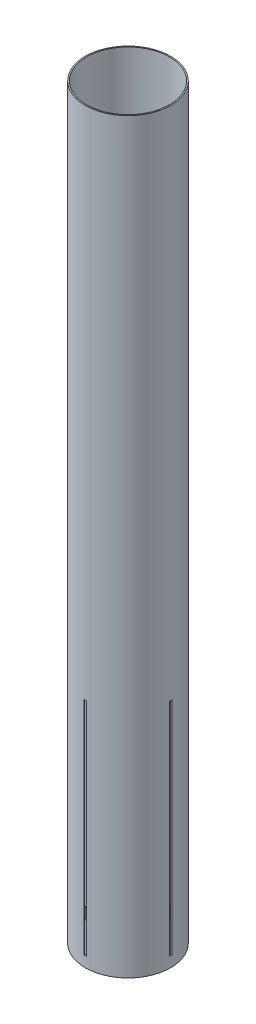
from build123d import *

# Parameters (mm, degrees)
SUSTAINER_TUBE_PROFILE_R   = 78.359
SUSTAINER_TUBE_PROFILE_R_2 = 76.2
SUSTAINER_TUBE_BODY_DEPTH  = 1371.6
FIN_SLOT_CUT_REACH         = 1384.746
FIN_SLOT_CUT_END_RADIUS    = 76.2
FIN_SLOT_PROFILE_W         = 4.7625
FIN_SLOT_PROFILE_H         = 406.4
FIN_SLOT_PATTERN_COUNT     = 4


with BuildPart() as part:
    # Sustainer Tube Profile → Sustainer Tube Body (new body)
    with BuildSketch(Plane(origin=(0, 0, 0), x_dir=(1, 0, 0), z_dir=(0, 1, 0))):
        Circle(SUSTAINER_TUBE_PROFILE_R)
        Circle(SUSTAINER_TUBE_PROFILE_R_2, mode=Mode.SUBTRACT)
    extrude(amount=SUSTAINER_TUBE_BODY_DEPTH)

    # Fin Slot Cut: up to this cylinder (the profile starts outside it)
    fin_slot_cut_end = Plane(origin=(0, 222.25, 0), z_dir=(0, -1, 0)) * Cylinder(FIN_SLOT_CUT_END_RADIUS, 2922.892, mode=Mode.PRIVATE)
    # Fin Slot Profile → Fin Slot Cut (cut, up to the surface)
    with BuildSketch(Plane.XY.offset(78.359), mode=Mode.PRIVATE) as fin_slot_cut_sk1:
        with Locations((0, 222.25)):
            Rectangle(FIN_SLOT_PROFILE_W, FIN_SLOT_PROFILE_H)
    fin_slot_cut_tool1 = extrude(fin_slot_cut_sk1.sketch, amount=-FIN_SLOT_CUT_REACH, mode=Mode.PRIVATE) - fin_slot_cut_end
    fin_slot_cut = fin_slot_cut_tool1.solids().sort_by_distance((0, 222.25, 78.359))[0]
    add(fin_slot_cut, mode=Mode.SUBTRACT)

    # Fin Slot Pattern: Fin Slot Cut ×4 about axis
    fin_slot_pattern_axis = Axis((0, 1371.6, 0), (0, 1, 0))
    for i in range(1, FIN_SLOT_PATTERN_COUNT):
        add(fin_slot_cut.rotate(fin_slot_pattern_axis, i * 360 / FIN_SLOT_PATTERN_COUNT), mode=Mode.SUBTRACT)


solid = part.part
